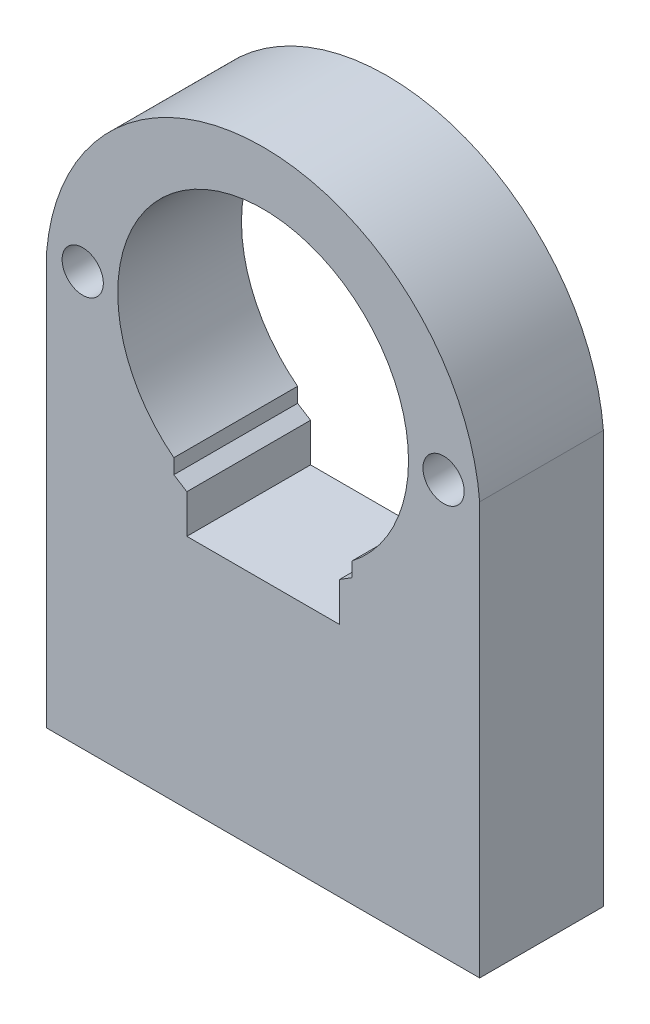
from build123d import *

# Parameters (mm, degrees)
BOSS_EXTRUDE1_DEPTH = 12
CUT_EXTRUDE1_DEPTH  = 39.264597805
SKETCH5_R           = 2
CUT_EXTRUDE2_DEPTH  = 39.264597805


with BuildPart() as part:
    # Sketch1 → Boss-Extrude1 (new body)
    with BuildSketch(Plane.XY):
        with BuildLine():
            Line((-21, 10.349039726), (-21, -29.650960274))
            Line((-21, -29.650960274), (21, -29.650960274))
            Line((21, -29.650960274), (21, 10.349039726))
            ThreePointArc((21, 10.349039726), (0, 29.650960274), (-21, 10.349039726))
        make_face()
        with BuildLine():
            Line((-7.4, -1.653043426), (-7.4, -6.750960274))
            Line((-7.4, -6.750960274), (7.4, -6.750960274))
            Line((7.4, -6.750960274), (7.4, -1.653043426))
            ThreePointArc((7.4, -1.653043426), (11.324405998, 1.94857374), (13.632681321, 6.749039726))
            ThreePointArc((13.632681321, 6.749039726), (14.1, 10.349039726), (13.632681321, 13.949039726))
            ThreePointArc((13.632681321, 13.949039726), (0, 24.449039726), (-13.632681321, 13.949039726))
            ThreePointArc((-13.632681321, 13.949039726), (-14.1, 10.349039726), (-13.632681321, 6.749039726))
            ThreePointArc((-13.632681321, 6.749039726), (-11.324405998, 1.94857374), (-7.4, -1.653043426))
        make_face(mode=Mode.SUBTRACT)
    extrude(amount=BOSS_EXTRUDE1_DEPTH)

    # Sketch4 → Cut-Extrude1 (cut, through all)
    with BuildSketch(Plane(origin=(0, 0, 0), x_dir=(-1, 0, 0), z_dir=(0, 0, -1))):
        Polygon((-8.60892416, -0.756105864), (-8.60892416, -2.220476265), (-7.390071816, -2.98523677), (-7.390071816, -1.635024077), align=None)
        Polygon((7.380412113, -3.013741616), (7.380412113, -1.659323223), (8.660307023, -0.698397939), (8.660307023, -2.210680373), align=None)
    extrude(amount=-CUT_EXTRUDE1_DEPTH, mode=Mode.SUBTRACT)

    # Sketch5 → Cut-Extrude2 (cut, through all)
    with BuildSketch(Plane(origin=(0, 0, 0), x_dir=(-1, 0, 0), z_dir=(0, 0, -1))):
        with Locations((-17.5, 10.449002275)):
            Circle(SKETCH5_R)
        with Locations((17.5, 10.449002275)):
            Circle(SKETCH5_R)
    extrude(amount=-CUT_EXTRUDE2_DEPTH, mode=Mode.SUBTRACT)


solid = part.part
